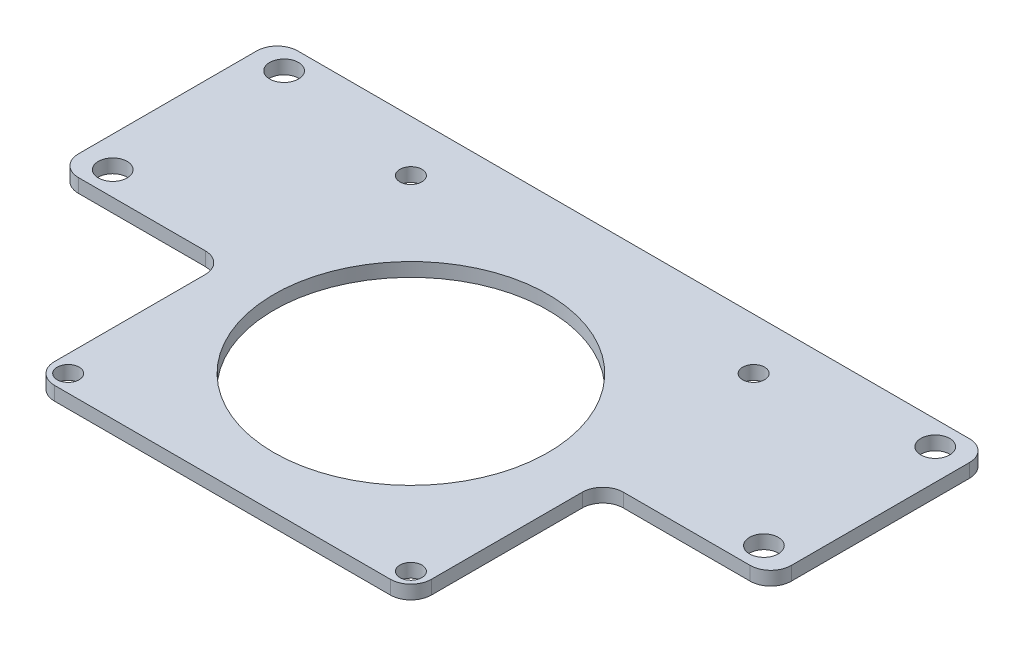
from build123d import *

# Parameters (mm, degrees)
SKETCH_1_R      = 20
SKETCH_1_R_2    = 2.1
SKETCH_1_R_3    = 1.6
EXTRUDE_1_DEPTH = 2
FILLET_1_R      = 3


with BuildPart() as part:
    # 草图1 → 凸台-拉伸1 (new body)
    with BuildSketch(Plane(origin=(0, 0, 0), x_dir=(1, 0, 0), z_dir=(0, 1, 0))):
        Polygon((52, 16), (-52, 16), (-52, -16), (-27.5, -16), (-27.5, -44), (27.5, -44), (27.5, -16), (52, -16), align=None)
        with Locations((0, -16.5)):
            Circle(SKETCH_1_R, mode=Mode.SUBTRACT)
        with Locations((-47.5, -12.5)):
            Circle(SKETCH_1_R_2, mode=Mode.SUBTRACT)
        with Locations((-47.5, 12.5)):
            Circle(SKETCH_1_R_2, mode=Mode.SUBTRACT)
        with Locations((-25, 8.5)):
            Circle(SKETCH_1_R_3, mode=Mode.SUBTRACT)
        with Locations((47.5, -12.5)):
            Circle(SKETCH_1_R_2, mode=Mode.SUBTRACT)
        with Locations((25, 8.5)):
            Circle(SKETCH_1_R_3, mode=Mode.SUBTRACT)
        with Locations((47.5, 12.5)):
            Circle(SKETCH_1_R_2, mode=Mode.SUBTRACT)
        with Locations((25, -41.5)):
            Circle(SKETCH_1_R_3, mode=Mode.SUBTRACT)
        with Locations((-25, -41.5)):
            Circle(SKETCH_1_R_3, mode=Mode.SUBTRACT)
    extrude(amount=EXTRUDE_1_DEPTH)

    # 圆角1
    fillet_1_edges = [part.edges().sort_by_distance(p)[0] for p in [
        (52, 1, -16),
        (52, 1, 16),
        (27.5, 1, 16),
        (27.5, 1, 44),
        (-27.5, 1, 44),
        (-27.5, 1, 16),
        (-52, 1, 16),
        (-52, 1, -16),
    ]]
    fillet(fillet_1_edges, radius=FILLET_1_R)


solid = part.part
